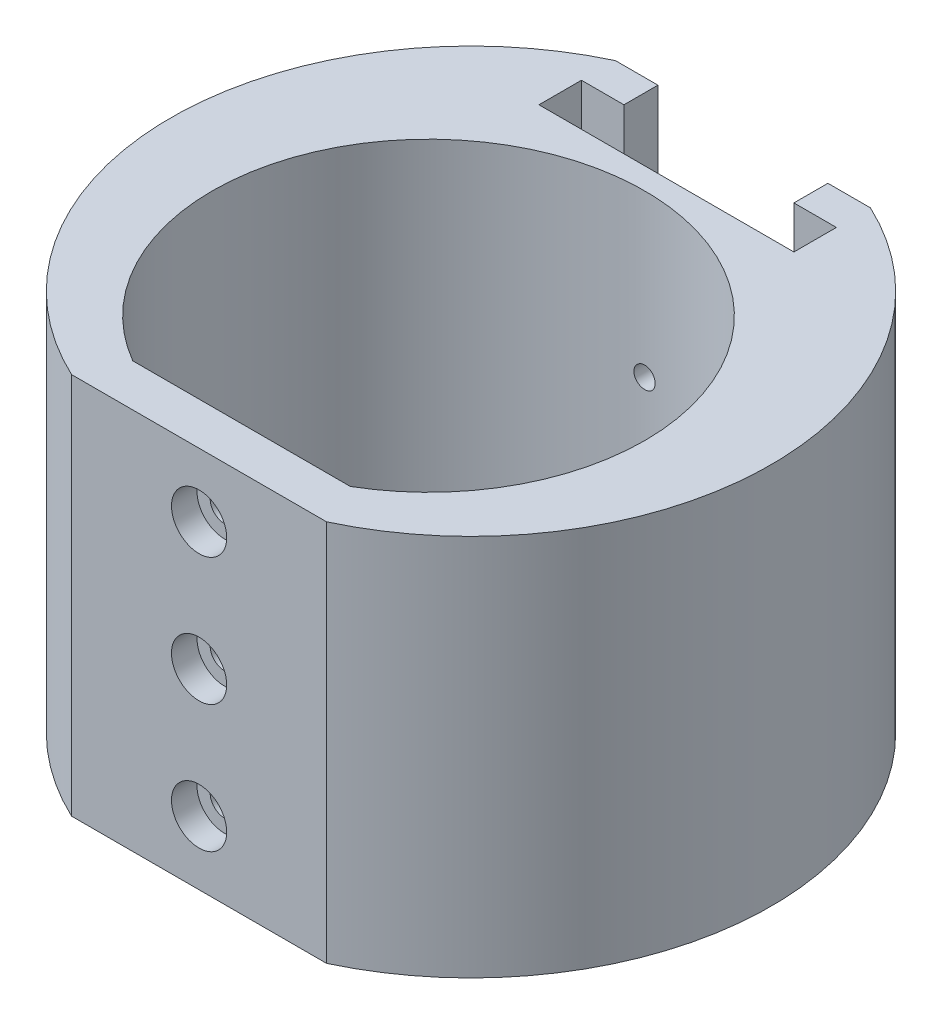
from build123d import *

# Parameters (mm, degrees)
BOSS_EXTRUDE1_DEPTH            = 22.5
CUT_EXTRUDE1_DEPTH             = 36
CBORE_FOR_M3_SHCS1_D           = 3.4
CBORE_FOR_M3_SHCS1_DEPTH       = 5
CBORE_FOR_M3_SHCS1_CBORE_D     = 6.5
CBORE_FOR_M3_SHCS1_CBORE_DEPTH = 3
CBORE_FOR_M3_SHCS1_TIP         = 1.021463052
M3X0_5_TAPPED_HOLE1_D          = 2.5
M3X0_5_TAPPED_HOLE1_DEPTH      = 25.54449211
M3X0_5_TAPPED_HOLE1_TIP        = 0.751075774
FILLET2_R                      = 4
TOLERANCING_START              = -22.5
TOLERANCING_DEPTH              = 45


# Read off the part's stored shape, not the designer's step: Tolerancing
with BuildPart() as part:
    # Sketch1 → Boss-Extrude1 (new, symmetric)
    with BuildSketch(Plane(origin=(0, 0, 0), x_dir=(1, 0, 0), z_dir=(0, 1, 0))):
        with BuildLine():
            Line((-15, -26.997045256), (15, -26.997045256))
            ThreePointArc((15, -26.997045256), (35.338518717, 5), (15, 36.997045256))
            Line((15, 36.997045256), (-15, 36.997045256))
            ThreePointArc((-15, 36.997045256), (-35.338518717, 5), (-15, -26.997045256))
        make_face()
        with BuildLine():
            Line((-12.7, -21.997045256), (12.7, -21.997045256))
            ThreePointArc((12.7, -21.997045256), (0, 25.4), (-12.7, -21.997045256))
        make_face(mode=Mode.SUBTRACT)
    extrude(amount=BOSS_EXTRUDE1_DEPTH, both=True)

    # Sketch4 → Cut-Extrude1 (cut)
    with BuildSketch(Plane(origin=(0, 22.5, 0), x_dir=(1, 0, 0), z_dir=(0, 1, 0))):
        Polygon((-10, 36.997045256), (-10, 32.997045256), (-15, 32.997045256), (-15, 27.997045256), (15, 27.997045256), (15, 32.997045256), (10, 32.997045256), (10, 36.997045256), align=None)
    extrude(amount=-CUT_EXTRUDE1_DEPTH, mode=Mode.SUBTRACT)

    # CBORE for M3 SHCS1
    with Locations(Plane.XY.offset(26.997045256)):
        with Locations((0, 0), (0, 15), (0, -15)):
            CounterBoreHole(CBORE_FOR_M3_SHCS1_D / 2, CBORE_FOR_M3_SHCS1_CBORE_D / 2, CBORE_FOR_M3_SHCS1_CBORE_DEPTH, depth=CBORE_FOR_M3_SHCS1_DEPTH)
            with Locations((0, 0, -(CBORE_FOR_M3_SHCS1_DEPTH + CBORE_FOR_M3_SHCS1_TIP / 2))):  # 118° drill point
                Cone(0, CBORE_FOR_M3_SHCS1_D / 2, CBORE_FOR_M3_SHCS1_TIP, mode=Mode.SUBTRACT)

    # M3x0.5 Tapped Hole1
    with Locations(Plane(origin=(0, 0, -27.997045256), x_dir=(-1, 0, 0), z_dir=(0, 0, -1))):
        with Locations((0, 3.5), (0, -6.5)):
            Hole(M3X0_5_TAPPED_HOLE1_D / 2, depth=M3X0_5_TAPPED_HOLE1_DEPTH)
            with Locations((0, 0, -(M3X0_5_TAPPED_HOLE1_DEPTH + M3X0_5_TAPPED_HOLE1_TIP / 2))):  # 118° drill point
                Cone(0, M3X0_5_TAPPED_HOLE1_D / 2, M3X0_5_TAPPED_HOLE1_TIP, mode=Mode.SUBTRACT)

    # Fillet2
    fillet2_edges = [part.edges().sort_by_distance(p)[0] for p in [
        (10, -13.5, -34.997045256),
        (15, -13.5, -30.497045256),
        (-15, -13.5, -30.497045256),
        (-10, -13.5, -34.997045256),
    ]]
    fillet(fillet2_edges, radius=FILLET2_R)

    # Tolerancing outline → Tolerancing (cut)
    with BuildSketch(Plane(origin=(0, 0, 0), x_dir=(1, 0, 0), z_dir=(0, 1, 0)).offset(TOLERANCING_START)):
        with BuildLine():
            ThreePointArc((12.799707028, -21.997045256), (0, 25.45), (-12.799707028, -21.997045256))
            Line((-12.799707028, -21.997045256), (-12.7, -21.997045256))
            ThreePointArc((-12.7, -21.997045256), (0, 25.4), (12.7, -21.997045256))
            Line((12.7, -21.997045256), (12.799707028, -21.997045256))
        make_face()
    extrude(amount=TOLERANCING_DEPTH, mode=Mode.SUBTRACT)


solid = part.part
